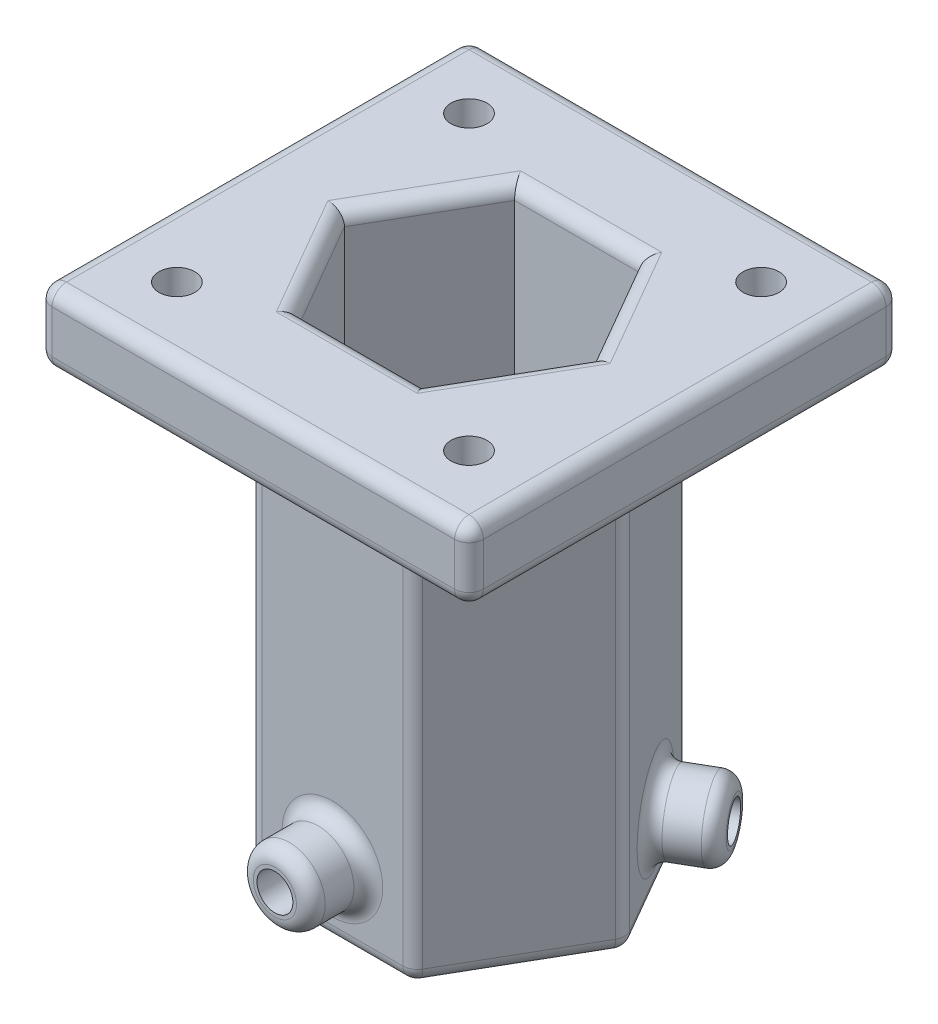
from build123d import *

# Parameters (mm, degrees)
SKETCH1_W            = 30
SKETCH1_H            = 30
BODY_DEPTH           = 5
SHAFT_DEPTH          = 35
SHAFTHOLE_DEPTH      = 56
SKETCH5_R            = 2.5
MOUNTSHELL_DEPTH     = 6
MOUNTHOLE_D          = 2.5
MOUNTHOLE_DEPTH      = 8.166429535
CIRPATTERN1_COUNT    = 3
MOUNTINGHOLES_D      = 2.5
LPATTERN1_COUNT      = 2
LPATTERN1_PITCH      = 20.32
LPATTERN1_COUNT_DIR2 = 2
LPATTERN1_PITCH_DIR2 = 20.32
FILLET1_R            = 1


with BuildPart() as part:
    # Sketch1 → Body (new body)
    with BuildSketch(Plane(origin=(0, 0, 0), x_dir=(1, 0, 0), z_dir=(0, 1, 0))):
        with Locations((15, 15)):
            Rectangle(SKETCH1_W, SKETCH1_H)
    extrude(amount=BODY_DEPTH)

    # Sketch2 → Shaft (add)
    with BuildSketch(Plane(origin=(0, 5, 0), x_dir=(1, 0, 0), z_dir=(0, 1, 0))):
        Polygon((25.969655115, 15), (20.484827557, 24.5), (9.515172443, 24.5), (4.030344885, 15), (9.515172443, 5.5), (20.484827557, 5.5), align=None)
    extrude(amount=-SHAFT_DEPTH)

    # Sketch3 → ShaftHole (cut, through all)
    with BuildSketch(Plane(origin=(0, 5, 0), x_dir=(1, 0, 0), z_dir=(0, 1, 0))):
        Polygon((23.660254038, 15), (19.330127019, 22.5), (10.669872981, 22.5), (6.339745962, 15), (10.669872981, 7.5), (19.330127019, 7.5), align=None)
    extrude(amount=-SHAFTHOLE_DEPTH, mode=Mode.SUBTRACT)

    # Sketch5 → MountShell (add)
    with BuildSketch(Plane(origin=(-1.740381057, 0, -1.004809472), x_dir=(0.5000000000000001, 0, -0.8660254037844386), z_dir=(0.8660254037844386, 0, 0.5000000000000001))):
        with Locations((20.490381057, -25)):
            Circle(SKETCH5_R)
    mountshell = extrude(amount=-MOUNTSHELL_DEPTH)

    # MountHole
    with Locations(Plane(origin=(8.504809472, -25, -18.75), x_dir=(-0.5, 0, 0.866025403784), z_dir=(0.866025403784, 0, 0.5))):
        with Locations((0, 0)):
            mounthole = Hole(MOUNTHOLE_D / 2, depth=MOUNTHOLE_DEPTH)

    # CirPattern1: MountShell, MountHole ×3 about axis
    cirpattern1_axis = Axis((15, 0, -15), (0, 1, 0))
    add([mountshell.rotate(cirpattern1_axis, i * 360 / CIRPATTERN1_COUNT) for i in range(1, CIRPATTERN1_COUNT)])
    add([mounthole.rotate(cirpattern1_axis, i * 360 / CIRPATTERN1_COUNT) for i in range(1, CIRPATTERN1_COUNT)], mode=Mode.SUBTRACT)

    # MountingHoles (through all)
    with Locations(Plane(origin=(4.84, 5, -25.16), x_dir=(0, 0, 1), z_dir=(0, 1, 0))):
        with Locations((0, 0)):
            mountingholes = Hole(MOUNTINGHOLES_D / 2)

    # LPattern1: MountingHoles 2 × 2
    with Locations(*[(j * LPATTERN1_PITCH_DIR2, 0, i * LPATTERN1_PITCH) for i in range(LPATTERN1_COUNT) for j in range(LPATTERN1_COUNT_DIR2) if (i, j) != (0, 0)]):
        add(mountingholes, mode=Mode.SUBTRACT)

    # Fillet1
    fillet1_edges = [part.edges().sort_by_distance(p)[0] for p in [
        (15, 5, -30),
        (0, 5, -15),
        (15, 0, -24.5),
        (6.772758664, 0, -19.75),
        (6.772758664, 0, -10.25),
        (15, 0, -5.5),
        (23.227241336, 0, -10.25),
        (23.227241336, 0, -19.75),
        (23.227241336, -30, -19.75),
        (20.484827557, -15, -24.5),
        (23.227241336, -30, -10.25),
        (25.969655115, -15, -15),
        (15, -30, -5.5),
        (20.484827557, -15, -5.5),
        (6.772758664, -30, -10.25),
        (9.515172443, -15, -5.5),
        (6.772758664, -30, -19.75),
        (4.030344885, -15, -15),
        (15, -30, -24.5),
        (9.515172443, -15, -24.5),
        (15, 5, 0),
        (0, 0, -15),
        (21.495190528, -30, -11.25),
        (15, -30, -7.5),
        (8.504809472, -30, -11.25),
        (8.504809472, -30, -18.75),
        (15, -30, -22.5),
        (21.495190528, -30, -18.75),
        (21.495190528, 5, -11.25),
        (21.495190528, 5, -18.75),
        (15, 5, -22.5),
        (8.504809472, 5, -18.75),
        (8.504809472, 5, -11.25),
        (15, 0, -30),
        (15, 5, -7.5),
        (30, 0, -15),
        (15, 0, 0),
        (5.522758664, -25, -17.584936491),
        (2.058657049, -25, -19.584936491),
        (30, 5, -15),
        (0, 2.5, 0),
        (17.5, -25, -5.5),
        (0, 2.5, -30),
        (17.5, -25, -1.5),
        (30, 2.5, -30),
        (30, 2.5, 0),
        (21.977241336, -25, -21.915063509),
        (25.441342951, -25, -23.915063509),
    ]]
    fillet(fillet1_edges, radius=FILLET1_R - 0.0001)  # a hair under: the kernel refuses the full size


solid = part.part
